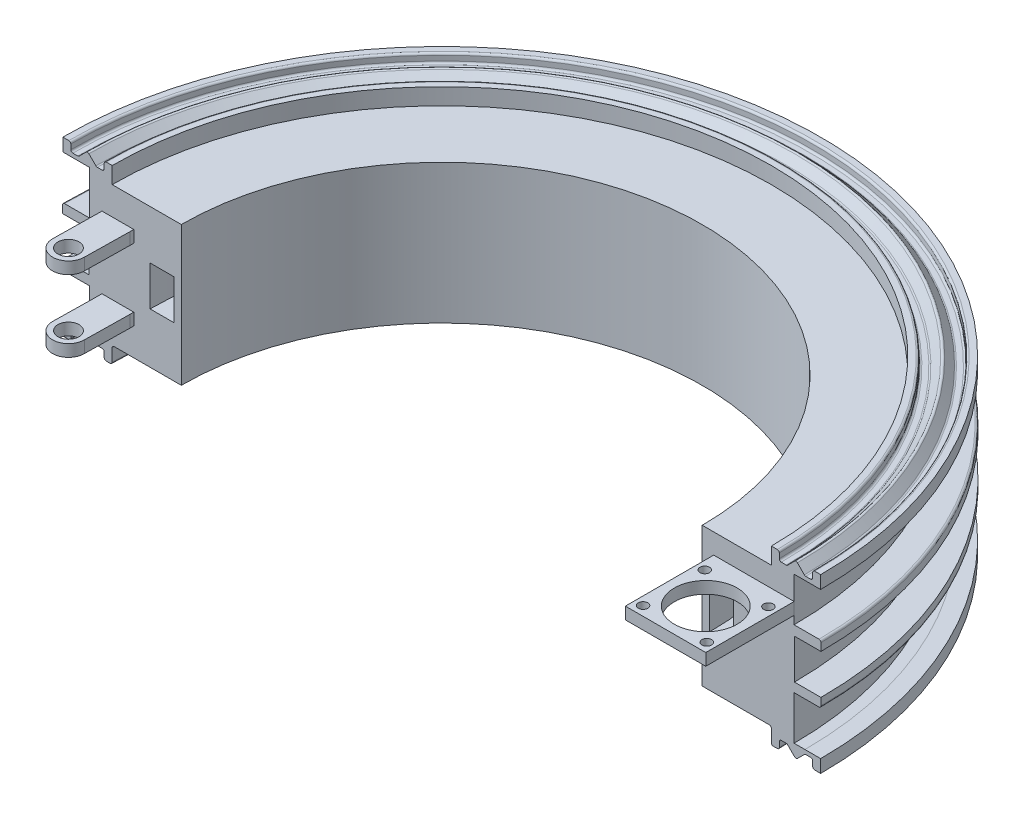
from build123d import *

# Parameters (mm, degrees)
SKETCH1_W           = 6
SKETCH1_H           = 10
FILLET1_R           = 0.5
FILLET2_R           = 0.5
FILLET3_R           = 0.5
FILLET4_R           = 0.5
FILLET5_R           = 0.5
FILLET6_R           = 0.5
FILLET7_R           = 0.5
FILLET9_R           = 0.5
FILLET10_R          = 0.5
SKETCH13_W          = 8
SKETCH13_H          = 3
BOSS_EXTRUDE6_DEPTH = 1
SKETCH19_R          = 2.65
BOSS_EXTRUDE7_DEPTH = 3
SKETCH17_W          = 20.2
SKETCH17_H          = 3
BOSS_EXTRUDE8_DEPTH = 22.2
SKETCH21_R          = 7.9
SKETCH21_R_2        = 1.2
CUT_EXTRUDE3_DEPTH  = 22.2


with BuildPart() as part:
    # Sweep3: sweep along a path in Sketch3
    with BuildLine(Plane(origin=(0, 0, 0), x_dir=(1, 0, 0), z_dir=(0, 1, 0))) as sweep3_path:
        ThreePointArc((0, 0), (65.459977148, 65.459977148), (130.919954296, 0))
    # Sketch1 → Sweep3 (sweep)
    with BuildSketch(Plane.XY):
        Polygon((0, 21.243112223), (0, -13.756887777), (-17.368376618, -13.756887777), (-17.368376618, -17.916258724), (-19.368376618, -17.916258724), (-19.368376618, -15.656355089), (-21.318376618, -15.656355089), (-23.568376618, -17.906355089), (-25.818376618, -15.656355089), (-27.768376618, -15.656355089), (-27.768376618, -17.900013904), (-29.768376618, -17.900013904), (-29.768376618, -14.656355089), (-25.818376618, -14.656355089), (-23.090911996, -14.656355089), (-23.090911996, -3.637682855), (-29.846967972, -3.637682855), (-29.846967972, -1.30053875), (-23.179563182, -1.30053875), (-23.179563182, 8.69946125), (-29.846967972, 8.69946125), (-29.846967972, 11.1239073), (-23.090911996, 11.1239073), (-23.090911996, 22.142579535), (-25.818376618, 22.142579535), (-29.768376618, 22.142579535), (-29.768376618, 25.386238349), (-27.768376618, 25.386238349), (-27.768376618, 23.142579535), (-25.818376618, 23.142579535), (-23.568376618, 25.392579535), (-21.318376618, 23.142579535), (-19.368376618, 23.142579535), (-19.368376618, 25.402483169), (-17.368376618, 25.402483169), (-17.368376618, 21.243112223), align=None)
        with Locations((-4.842428612, 3.950784343)):
            Rectangle(SKETCH1_W, SKETCH1_H, mode=Mode.SUBTRACT)
    sweep(path=sweep3_path.line)

    # Fillet1
    fillet1_edges = [part.edges().sort_by_distance(p)[0] for p in [
        (65.459977148, 25.392579535, -89.028353766),
    ]]
    fillet(fillet1_edges, radius=FILLET1_R)

    # Fillet2
    fillet2_edges = [part.edges().sort_by_distance(p)[0] for p in [
        (65.459977148, 23.142579535, -91.278353766),
    ]]
    fillet(fillet2_edges, radius=FILLET2_R)

    # Fillet3
    fillet3_edges = [part.edges().sort_by_distance(p)[0] for p in [
        (65.459977148, 23.142579535, -93.228353766),
    ]]
    fillet(fillet3_edges, radius=FILLET3_R)

    # Fillet4
    fillet4_edges = [part.edges().sort_by_distance(p)[0] for p in [
        (65.459977148, 23.142579535, -84.828353766),
        (65.459977148, 23.142579535, -86.778353766),
    ]]
    fillet(fillet4_edges, radius=FILLET4_R)

    # Fillet5
    fillet5_edges = [part.edges().sort_by_distance(p)[0] for p in [
        (65.459977148, -17.916258724, -84.828353766),
        (65.459977148, -15.656355089, -86.778353766),
        (65.459977148, -17.906355089, -89.028353766),
    ]]
    fillet(fillet5_edges, radius=FILLET5_R)

    # Fillet6
    fillet6_edges = [part.edges().sort_by_distance(p)[0] for p in [
        (65.459977148, -13.756887777, -82.828353766),
        (65.459977148, -17.916258724, -82.828353766),
        (65.459977148, -15.656355089, -84.828353766),
    ]]
    fillet(fillet6_edges, radius=FILLET6_R)

    # Fillet7
    fillet7_edges = [part.edges().sort_by_distance(p)[0] for p in [
        (65.459977148, -15.656355089, -91.278353766),
        (65.459977148, -17.900013904, -93.228353766),
        (65.459977148, -15.656355089, -93.228353766),
    ]]
    fillet(fillet7_edges, radius=FILLET7_R)

    # Fillet9
    fillet9_edges = [part.edges().sort_by_distance(p)[0] for p in [
        (65.459977148, -3.637682855, -95.30694512),
        (65.459977148, 11.1239073, -95.30694512),
    ]]
    fillet(fillet9_edges, radius=FILLET9_R)

    # Fillet10
    fillet10_edges = [part.edges().sort_by_distance(p)[0] for p in [
        (65.459977148, 25.386238349, -93.228353766),
        (65.459977148, 25.402483169, -84.828353766),
    ]]
    fillet(fillet10_edges, radius=FILLET10_R)

    # Sketch13 → Boss-Extrude6 (add)
    with BuildSketch(Plane.XY):
        with Locations((-15.938702062, -5.30053875)):
            Rectangle(SKETCH13_W, SKETCH13_H)
        with Locations((-15.938702062, 12.69946125)):
            Rectangle(SKETCH13_W, SKETCH13_H)
    boss_extrude6 = extrude(amount=BOSS_EXTRUDE6_DEPTH)

    # Sketch19 → Boss-Extrude7 (add)
    with BuildSketch(Plane(origin=(0, 14.19946125, 0), x_dir=(1, 0, 0), z_dir=(0, 1, 0))):
        with BuildLine():
            Line((-11.938702062, -1), (-19.938702062, -1))
            Line((-19.938702062, -1), (-20.115344974, -12.237624493))
            ThreePointArc((-20.115344974, -12.237624493), (-16.115344974, -16.237624493), (-12.115344974, -12.237624493))
            Line((-12.115344974, -12.237624493), (-11.938702062, -1))
        make_face()
        with Locations((-16.115344974, -12.237624493)):
            Circle(SKETCH19_R, mode=Mode.SUBTRACT)
    boss_extrude7 = extrude(amount=-BOSS_EXTRUDE7_DEPTH)

    # Mirror1: Boss-Extrude6, Boss-Extrude7 across plane
    add(boss_extrude6.mirror(Plane.ZX.offset(3.69946125)))
    add(boss_extrude7.mirror(Plane.ZX.offset(3.69946125)))

    # Sketch17 → Boss-Extrude8 (add)
    with BuildSketch(Plane.XY):
        with Locations((143.910866292, 14.693112223)):
            Rectangle(SKETCH17_W, SKETCH17_H)
    extrude(amount=BOSS_EXTRUDE8_DEPTH)

    # Sketch21 → Cut-Extrude3 (cut)
    with BuildSketch(Plane.XZ.offset(-13.193112223)):
        with Locations((143.910866292, 12.1)):
            Circle(SKETCH21_R)
        with Locations((135.908547878, 19.85)):
            Circle(SKETCH21_R_2)
        with Locations((135.908547878, 4.35)):
            Circle(SKETCH21_R_2)
        with Locations((151.913184706, 4.35)):
            Circle(SKETCH21_R_2)
        with Locations((151.913184706, 19.85)):
            Circle(SKETCH21_R_2)
    extrude(amount=-CUT_EXTRUDE3_DEPTH, mode=Mode.SUBTRACT)


solid = part.part
